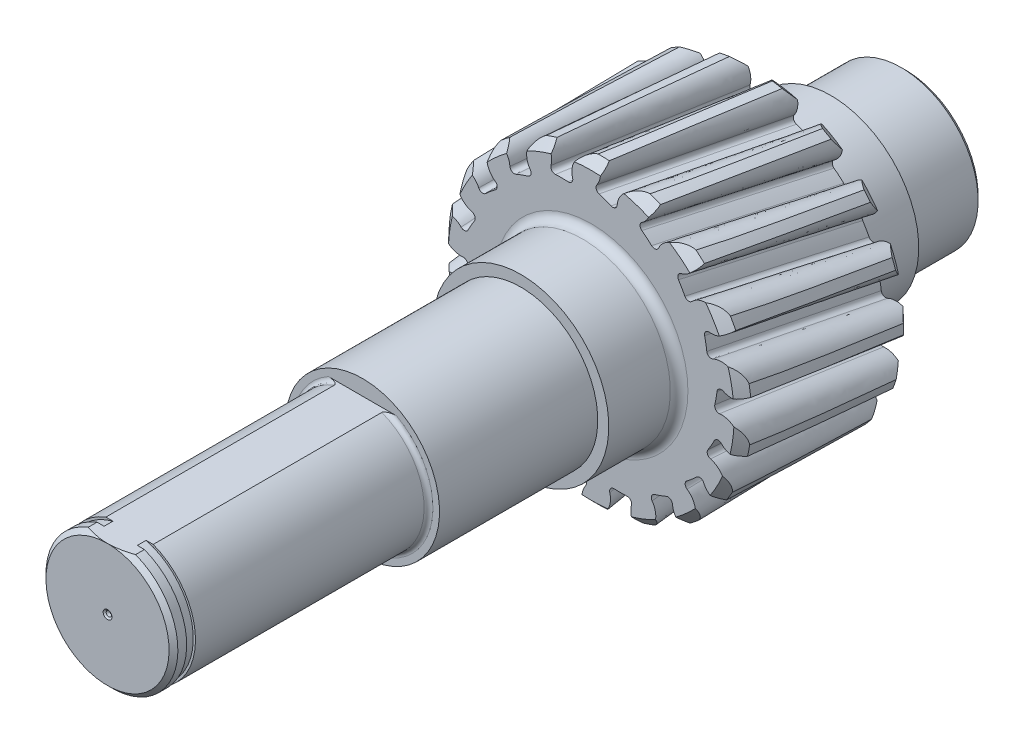
from build123d import *

# Parameters (mm, degrees)
SECTION_NO_1_DEPTH          = 58
SKETCH2_R                   = 17.5
SECTION_NO_2_DEPTH          = 36
SKETCH3_R                   = 20
SECTION_NO_3_DEPTH          = 16
SKETCH4_R                   = 34.5
SECTION_NO_4_DEPTH          = 38.5
SKETCH5_R                   = 20
SECTION_NO_5_DEPTH          = 16
SKETCH6_R                   = 17.5
SECTION_NO_6_DEPTH          = 17
SECTION_NO_1_CHAMFER_SIZE   = 1
SECTION_NO_6_CHAMFER_SIZE   = 1
SECTION_NO_1_2_FILLET_R     = 1
SECTION_NO_3_4_4_5_FILLET_R = 2
TOOTH_CHAMFER_SIZE          = 2
CUT_EXTRUDE3_START          = -2
SKETCH20_R                  = 15
SKETCH20_R_2                = 14.5
CUT_EXTRUDE3_DEPTH          = 2
CIRPATTERN1_COUNT           = 18


with BuildPart() as part:
    # Sketch1 → Section No.1 (new body)
    with BuildSketch(Plane.XY):
        with BuildLine():
            Line((-34.100595433, 32.448307953), (-23.330265819, 32.448307953))
            ThreePointArc((-23.330265819, 32.448307953), (-28.715430626, 3.448307953), (-34.100595433, 32.448307953))
        make_face()
    extrude(amount=SECTION_NO_1_DEPTH)

    # Sketch2 → Section No.2 (add)
    with BuildSketch(Plane(origin=(0, 0, 0), x_dir=(-1, 0, 0), z_dir=(0, 0, -1))):
        with Locations((28.715430626, 18.448307953)):
            Circle(SKETCH2_R)
    extrude(amount=SECTION_NO_2_DEPTH)

    # Sketch3 → Section No.3 (add)
    with BuildSketch(Plane(origin=(0, 0, -36), x_dir=(-1, 0, 0), z_dir=(0, 0, -1))):
        with Locations((28.715430626, 18.448307953)):
            Circle(SKETCH3_R)
    extrude(amount=SECTION_NO_3_DEPTH)

    # Sketch4 → Section No.4 (add)
    with BuildSketch(Plane(origin=(0, 0, -52), x_dir=(-1, 0, 0), z_dir=(0, 0, -1))):
        with Locations((28.715430626, 18.448307953)):
            Circle(SKETCH4_R)
    extrude(amount=SECTION_NO_4_DEPTH)

    # Sketch5 → Section No.5 (add)
    with BuildSketch(Plane(origin=(0, 0, -90.5), x_dir=(-1, 0, 0), z_dir=(0, 0, -1))):
        with Locations((28.715430626, 18.448307953)):
            Circle(SKETCH5_R)
    extrude(amount=SECTION_NO_5_DEPTH)

    # Sketch6 → Section No.6 (add)
    with BuildSketch(Plane(origin=(0, 0, -106.5), x_dir=(-1, 0, 0), z_dir=(0, 0, -1))):
        with Locations((28.715430626, 18.448307953)):
            Circle(SKETCH6_R)
    extrude(amount=SECTION_NO_6_DEPTH)

    # Section No.1 chamfer
    section_no_1_chamfer_edges = [part.edges().sort_by_distance(p)[0] for p in [
        (-28.715430626, 3.448307953, 58),
    ]]
    chamfer(section_no_1_chamfer_edges, length=SECTION_NO_1_CHAMFER_SIZE - 0.0001)  # a hair under: the kernel refuses the full size

    # Section No.6 chamfer
    section_no_6_chamfer_edges = [part.edges().sort_by_distance(p)[0] for p in [
        (-11.215430626, 18.448307953, -123.5),
    ]]
    chamfer(section_no_6_chamfer_edges, length=SECTION_NO_6_CHAMFER_SIZE)

    # Section No.1-2 fillet
    section_no_1_2_fillet_edges = [part.edges().sort_by_distance(p)[0] for p in [
        (-28.715430626, 3.448307953, 0),
    ]]
    fillet(section_no_1_2_fillet_edges, radius=SECTION_NO_1_2_FILLET_R)

    # Section No.3-4,4-5 fillet
    section_no_3_4_4_5_fillet_edges = [part.edges().sort_by_distance(p)[0] for p in [
        (-8.715430626, 18.448307953, -52),
        (-8.715430626, 18.448307953, -90.5),
    ]]
    fillet(section_no_3_4_4_5_fillet_edges, radius=SECTION_NO_3_4_4_5_FILLET_R)

    # Sketch18 → Mounting hole No.1 (revolve, cut)
    with BuildSketch(Plane(origin=(-28.715430626, 18.448307953, 58), x_dir=(0, -1, 0), z_dir=(1, 0, 0))):
        Polygon((0, 0), (0, 0.579784595), (0.6, 0.3), (0.6, 0.4), (1, 0), align=None)
    revolve(axis=Axis((-28.715430626, 18.448307953, 64.35), (0, 0, -1)), mode=Mode.SUBTRACT)

    # Sketch17 → Mounting hole No.2 (revolve, cut)
    with BuildSketch(Plane(origin=(-28.715430626, 18.448307953, -123.5), x_dir=(0, 1, 0), z_dir=(1, 0, 0))):
        Polygon((0, 0), (0, 0.579784595), (0.6, 0.3), (0.6, 0.4), (1, 0), align=None)
    revolve(axis=Axis((-28.715430626, 18.448307953, -129.85), (0, 0, 1)), mode=Mode.SUBTRACT)

    # Tooth chamfer
    tooth_chamfer_edges = [part.edges().sort_by_distance(p)[0] for p in [
        (5.784569374, 18.448307953, -52),
        (5.784569374, 18.448307953, -90.5),
    ]]
    chamfer(tooth_chamfer_edges, length=TOOTH_CHAMFER_SIZE)

    # Sketch20 → Cut-Extrude3 (cut)
    with BuildSketch(Plane.XY.offset(55).offset(CUT_EXTRUDE3_START)):
        with Locations((-28.715430626, 18.448307953)):
            Circle(SKETCH20_R)
        with Locations((-28.715430626, 18.448307953)):
            Circle(SKETCH20_R_2, mode=Mode.SUBTRACT)
    extrude(amount=CUT_EXTRUDE3_DEPTH, mode=Mode.SUBTRACT)

    # Cut-Sweep1: sweep along a path in Sketch21
    with BuildLine(Plane(origin=(0, 53.499414442, 0), x_dir=(-1, 0, 0), z_dir=(0, 1, 0))) as cut_sweep1_path:
        Line((28.619126962, -90.5), (35.407715719, -52))
    # Sketch19 → Cut-Sweep1 (sweep, cut)
    with BuildSketch(Plane(origin=(0, 0, -90.5), x_dir=(-1, 0, 0), z_dir=(0, 0, -1))):
        with BuildLine():
            ThreePointArc((34.672452089, 52.972736341), (28.619126962, 53.499414442), (22.565801835, 52.972736341))
            ThreePointArc((22.565801835, 52.972736341), (25.615440289, 50.951312166), (26.155490612, 47.332638923))
            ThreePointArc((26.155490612, 47.332638923), (26.339252668, 46.439485716), (27.171473309, 46.066792885))
            ThreePointArc((27.171473309, 46.066792885), (28.619126962, 46.104708567), (30.066780615, 46.066792885))
            ThreePointArc((30.066780615, 46.066792885), (30.899001256, 46.439485716), (31.082763312, 47.332638923))
            ThreePointArc((31.082763312, 47.332638923), (31.622813635, 50.951312166), (34.672452089, 52.972736341))
        make_face()
    cut_sweep1 = sweep(path=cut_sweep1_path.line, mode=Mode.SUBTRACT)

    # CirPattern1: Cut-Sweep1 ×18 about axis
    cirpattern1_axis = Axis((-28.715430626, 18.448307953, -90.5), (0, 0, 1))
    for i in range(1, CIRPATTERN1_COUNT):
        add(cut_sweep1.rotate(cirpattern1_axis, i * 360 / CIRPATTERN1_COUNT), mode=Mode.SUBTRACT)


solid = part.part
